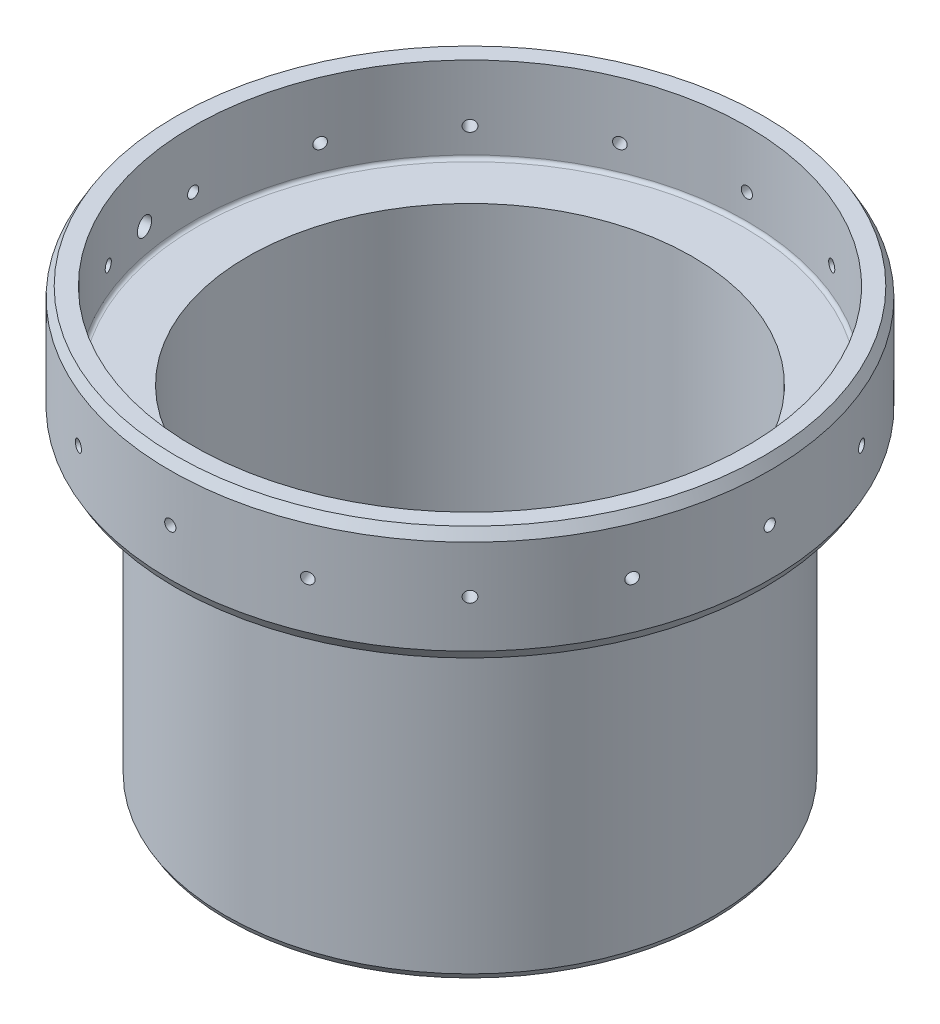
from build123d import *
from OCP.BRepFilletAPI import BRepFilletAPI_MakeChamfer

# Parameters (mm, degrees)
CIRPATTERN1_COUNT              = 16
TAP_DRILL_FOR_10_32_TAP1_D     = 4.0386
TAP_DRILL_FOR_10_32_TAP1_DEPTH = 10.16
TAP_DRILL_FOR_10_32_TAP1_TIP   = 1.213317848
CIRPATTERN2_COUNT              = 8
CHAMFER2_SIZE                  = 1.27
CHAMFER2_SIZE2                 = 2.199704526
CHAMFER4_SIZE                  = 0.762
CHAMFER4_SIZE2                 = 1.319822715
CHAMFER5_SIZE                  = 0.762
CHAMFER5_SIZE2                 = 1.319822715
FILLET1_R                      = 0.762


with BuildPart() as part:
    # Sketch1 → Revolve6 (revolve)
    with BuildSketch(Plane.XY):
        Polygon((-61.595, 0), (-66.675, 0), (-66.675, -25.4), (-54.5465, -25.4), (-54.5465, -95.25), (-49.4665, -95.25), (-49.4665, -19.05), (-61.595, -19.05), align=None)
    revolve(axis=Axis((0, 0, 0), (0, 1, 0)))

    # Sketch4 → Tap Drill for M3x0.5 Tap1 (revolve, cut)
    with BuildSketch(Plane(origin=(-66.675, -12.7, 0), x_dir=(0, 0, 1), z_dir=(0, 1, 0))):
        Polygon((0, 0), (0, 10.911075774), (1.25, 10.16), (1.25, 0), align=None)
    tap_drill_for_m3x0_5_tap1 = revolve(axis=Axis((-73.025, -12.7, 0), (1, 0, 0)), mode=Mode.SUBTRACT)

    # CirPattern1: Tap Drill for M3x0.5 Tap1 ×16 about axis
    cirpattern1_axis = Axis((0, 0, 0), (0, -1, 0))
    for i in range(1, CIRPATTERN1_COUNT):
        add(tap_drill_for_m3x0_5_tap1.rotate(cirpattern1_axis, i * 360 / CIRPATTERN1_COUNT), mode=Mode.SUBTRACT)

    # Tap Drill for #10-32 Tap1
    with Locations(Plane(origin=(-65.393858571, 0, 13.00764722), x_dir=(0.19509032201612886, 0, 0.9807852804032304), z_dir=(-0.9807852804032304, 0, 0.19509032201612886))):
        with Locations((0, -12.7)):
            Hole(TAP_DRILL_FOR_10_32_TAP1_D / 2, depth=TAP_DRILL_FOR_10_32_TAP1_DEPTH)
            with Locations((0, 0, -(TAP_DRILL_FOR_10_32_TAP1_DEPTH + TAP_DRILL_FOR_10_32_TAP1_TIP / 2))):  # 118° drill point
                Cone(0, TAP_DRILL_FOR_10_32_TAP1_D / 2, TAP_DRILL_FOR_10_32_TAP1_TIP, mode=Mode.SUBTRACT)

    # Sketch10 → Tap Drill for #4-40 Tap1 (revolve, cut)
    with BuildSketch(Plane(origin=(52.0065, -95.25, 0), x_dir=(0, 0, -1), z_dir=(1, 0, 0))):
        Polygon((0, 0), (0, 18.459152758), (1.1303, 17.78), (1.1303, 0), align=None)
    tap_drill_for_4_40_tap1 = revolve(axis=Axis((52.0065, -101.6, 0), (0, 1, 0)), mode=Mode.SUBTRACT)

    # CirPattern2: Tap Drill for #4-40 Tap1 ×8 about axis
    cirpattern2_axis = Axis((0, 0, 0), (0, -1, 0))
    for i in range(1, CIRPATTERN2_COUNT):
        add(tap_drill_for_4_40_tap1.rotate(cirpattern2_axis, i * 360 / CIRPATTERN2_COUNT), mode=Mode.SUBTRACT)

    # Chamfer2: one chamfer whose edges measure the first distance from different faces: ONE call of the kernel's chamfer builder (chamfer() names one face for all edges)
    chamfer2_edges_1 = [part.edges().sort_by_distance(p)[0] for p in [
        (66.675, -25.4, 0),
    ]]
    chamfer2_side_1 = [part.faces().sort_by_distance(p)[0] for p in [
        (64.789146215, -25.4, 0),
    ]]
    chamfer2_edges_2 = [part.edges().sort_by_distance(p)[0] for p in [
        (66.675, 0, 0),
    ]]
    chamfer2_side_2 = [part.faces().sort_by_distance(p)[0] for p in [
        (63.480853785, 0, 0),
    ]]
    chamfer2 = BRepFilletAPI_MakeChamfer(part.part.solid().wrapped)
    for e in chamfer2_edges_1:
        chamfer2.Add(CHAMFER2_SIZE, CHAMFER2_SIZE2, e.wrapped, chamfer2_side_1[0].wrapped)  # the first distance lies on this face
    for e in chamfer2_edges_2:
        chamfer2.Add(CHAMFER2_SIZE, CHAMFER2_SIZE2, e.wrapped, chamfer2_side_2[0].wrapped)  # the first distance lies on this face
    add(Compound.cast(chamfer2.Shape()), mode=Mode.REPLACE)

    # Chamfer4
    chamfer4_edges = [part.edges().sort_by_distance(p)[0] for p in [
        (54.5465, -95.25, 0),
    ]]
    chamfer4_side = [part.faces().sort_by_distance(p)[0] for p in [
        (54.3922192, -95.25, 0),
    ]]
    chamfer(chamfer4_edges, length=CHAMFER4_SIZE, length2=CHAMFER4_SIZE2, reference=chamfer4_side[0])

    # Chamfer5
    chamfer5_edges = [part.edges().sort_by_distance(p)[0] for p in [
        (49.4665, -95.25, 0),
    ]]
    chamfer5_side = [part.faces().sort_by_distance(p)[0] for p in [
        (53.632374461, -95.25, 0),
    ]]
    chamfer(chamfer5_edges, length=CHAMFER5_SIZE, length2=CHAMFER5_SIZE2, reference=chamfer5_side[0])

    # Fillet1
    fillet1_edges = [part.edges().sort_by_distance(p)[0] for p in [
        (54.5465, -25.4, 0),
        (61.595, -19.05, 0),
    ]]
    fillet(fillet1_edges, radius=FILLET1_R)


solid = part.part
